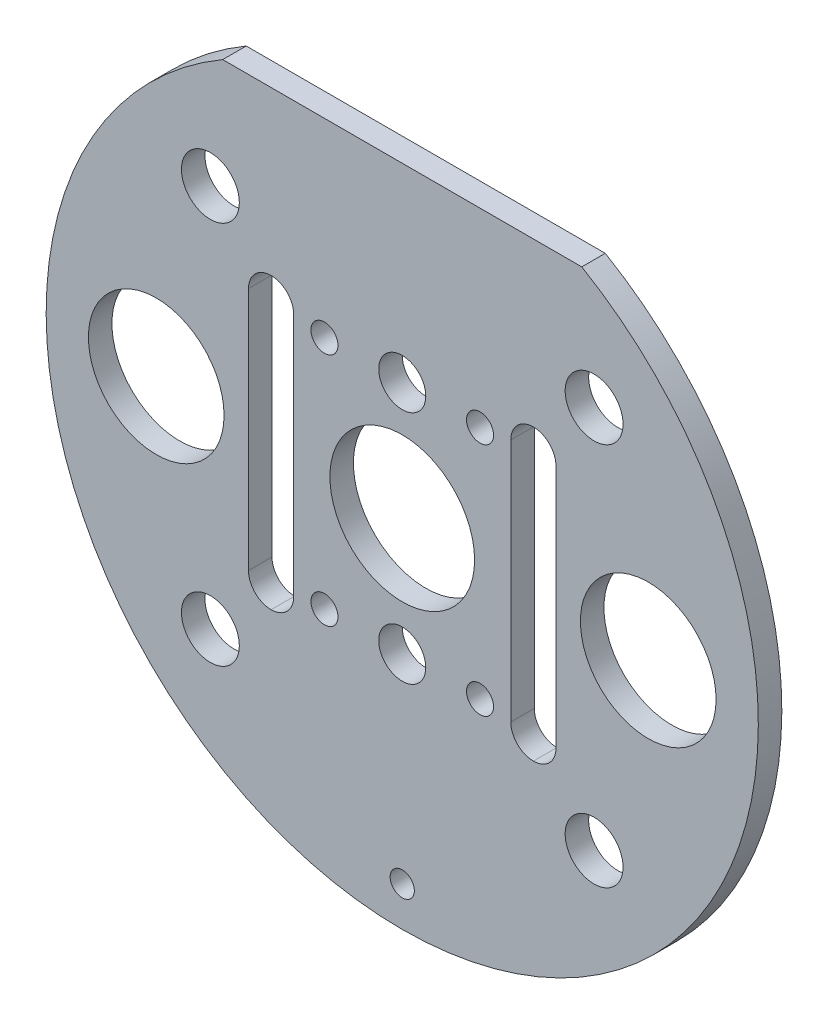
from build123d import *

# Parameters (mm, degrees)
SKETCH_1_R               = 50
EXTRUDE_1_DEPTH          = 3.302
SKETCH_2_R               = 4.064
CUT_EXTRUDE_1_DEPTH      = 71.787733429
SKETCH_3_W               = 50.417758776
SKETCH_3_H               = 15.226983209
CUT_EXTRUDE_2_DEPTH      = 71.787733429
SKETCH_4_R               = 10.16
CUT_EXTRUDE_3_DEPTH      = 71.787733429
SKETCH_8_R               = 9.525
SKETCH_8_W               = 6.35
SKETCH_8_H               = 40.64
CUT_EXTRUDE_4_DEPTH      = 71.787733429
SKETCH_9_R               = 1.9
SKETCH_9_R_2             = 3.302
CUT_EXTRUDE_5_DEPTH      = 71.787733429
FILLET1_R                = 3.175
M3_CLEARANCE_HOLE1_D     = 3.4
M3_CLEARANCE_HOLE1_DEPTH = 25.4
M3_CLEARANCE_HOLE1_TIP   = 1.021463052


with BuildPart() as part:
    # 草图1 → 凸台-拉伸1 (new body)
    with BuildSketch(Plane.XY):
        with Locations(Location((0, 0, 0), (0, 0, 180))):
            Circle(SKETCH_1_R)
    extrude(amount=EXTRUDE_1_DEPTH)

    # 草图2 → 切除-拉伸1 (cut, through all)
    with BuildSketch(Plane.XY.offset(3.302)):
        with Locations((-26.940768363, 26.940768363)):
            Circle(SKETCH_2_R)
        with Locations((-26.940768363, -26.940768363)):
            Circle(SKETCH_2_R)
        with Locations((26.940768363, -26.940768363)):
            Circle(SKETCH_2_R)
        with Locations((26.940768363, 26.940768363)):
            Circle(SKETCH_2_R)
    extrude(amount=-CUT_EXTRUDE_1_DEPTH, mode=Mode.SUBTRACT)

    # 草图3 → 切除-拉伸2 (cut, through all)
    with BuildSketch(Plane.XY.offset(3.302)):
        with Locations((0, 50.793491605)):
            Rectangle(SKETCH_3_W, SKETCH_3_H)
    extrude(amount=-CUT_EXTRUDE_2_DEPTH, mode=Mode.SUBTRACT)

    # 草图4 → 切除-拉伸3 (cut, through all)
    with BuildSketch(Plane.XY.offset(3.302)):
        Circle(SKETCH_4_R)
    extrude(amount=-CUT_EXTRUDE_3_DEPTH, mode=Mode.SUBTRACT)

    # 草图8 → 切除-拉伸4 (cut, through all)
    with BuildSketch(Plane.XY.offset(3.302)):
        with Locations((34.544, 0)):
            Circle(SKETCH_8_R)
        with Locations((-34.544, 0)):
            Circle(SKETCH_8_R)
        with Locations((18.415, 0)):
            Rectangle(SKETCH_8_W, SKETCH_8_H)
        with Locations((-18.415, 0)):
            Rectangle(SKETCH_8_W, SKETCH_8_H)
    extrude(amount=-CUT_EXTRUDE_4_DEPTH, mode=Mode.SUBTRACT)

    # 草图9 → 切除-拉伸5 (cut, through all)
    with BuildSketch(Plane.XY.offset(3.302)):
        with Locations((-10.922, 16.51)):
            Circle(SKETCH_9_R)
        with Locations((10.922, 16.51)):
            Circle(SKETCH_9_R)
        with Locations((-10.922, -16.51)):
            Circle(SKETCH_9_R)
        with Locations((10.922, -16.51)):
            Circle(SKETCH_9_R)
        with Locations((0, 16.51)):
            Circle(SKETCH_9_R_2)
        with Locations((0, -16.51)):
            Circle(SKETCH_9_R_2)
    extrude(amount=-CUT_EXTRUDE_5_DEPTH, mode=Mode.SUBTRACT)

    # Fillet1
    fillet1_edges = [part.edges().sort_by_distance(p)[0] for p in [
        (15.24, 20.32, 1.651),
        (21.59, 20.32, 1.651),
        (21.59, -20.32, 1.651),
        (15.24, -20.32, 1.651),
        (-15.24, -20.32, 1.651),
        (-21.59, -20.32, 1.651),
        (-15.24, 20.32, 1.651),
        (-21.59, 20.32, 1.651),
    ]]
    fillet(fillet1_edges, radius=FILLET1_R - 0.0001)  # a hair under: the kernel refuses the full size

    # M3 Clearance Hole1
    with Locations(Plane.XY.offset(3.302)):
        with Locations((0, -44.45)):
            Hole(M3_CLEARANCE_HOLE1_D / 2, depth=M3_CLEARANCE_HOLE1_DEPTH)
            with Locations((0, 0, -(M3_CLEARANCE_HOLE1_DEPTH + M3_CLEARANCE_HOLE1_TIP / 2))):  # 118° drill point
                Cone(0, M3_CLEARANCE_HOLE1_D / 2, M3_CLEARANCE_HOLE1_TIP, mode=Mode.SUBTRACT)


solid = part.part
